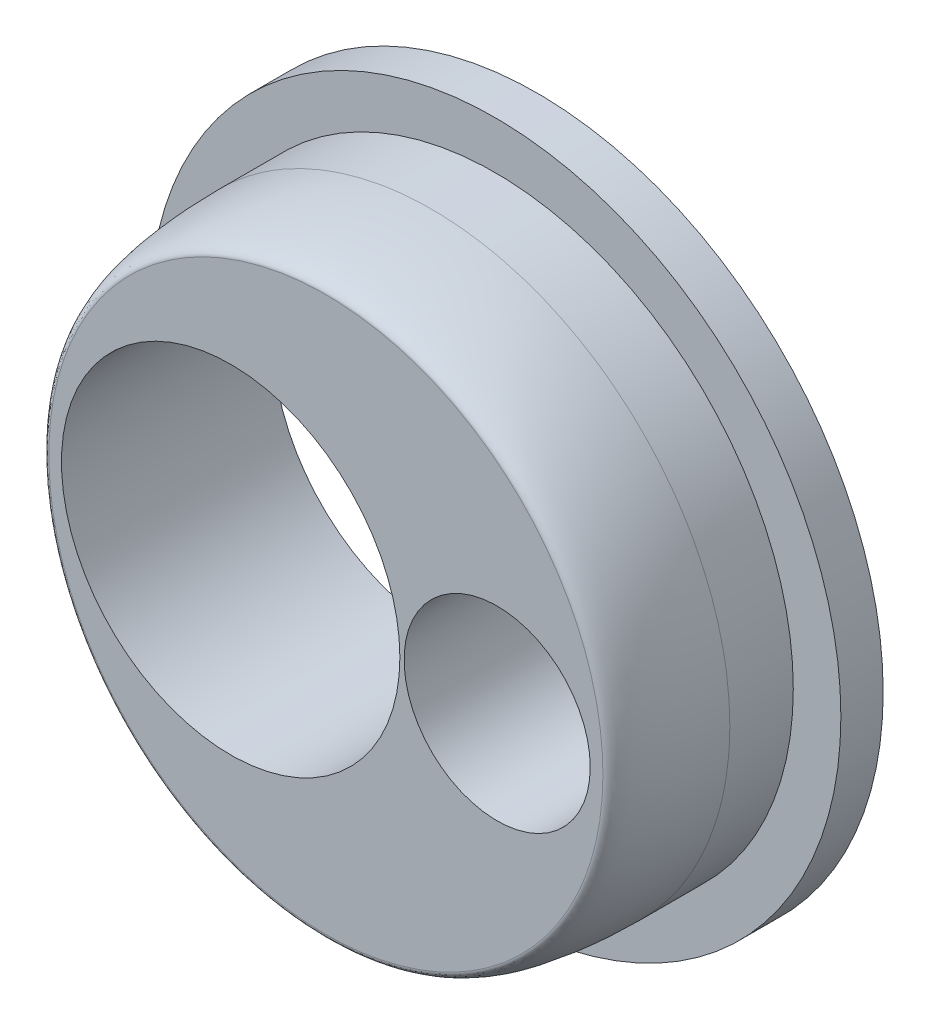
from build123d import *

# Parameters (mm, degrees)
SKETCH_1_R      = 16.35
SKETCH_1_R_2    = 4.4
SKETCH_1_R_3    = 8
EXTRUDE_1_DEPTH = 2
SKETCH_2_R      = 14.1
SKETCH_2_R_2    = 4.4
SKETCH_2_R_3    = 8
EXTRUDE_2_DEPTH = 8
FILLET_1_SIZE   = 5
FILLET_1_SIZE_2 = 1


with BuildPart() as part:
    # 草图1 → 凸台-拉伸1 (new body)
    with BuildSketch(Plane.XY):
        Circle(SKETCH_1_R)
        with Locations((8.1, 0)):
            Circle(SKETCH_1_R_2, mode=Mode.SUBTRACT)
        with Locations((-4.5, 0)):
            Circle(SKETCH_1_R_3, mode=Mode.SUBTRACT)
    extrude(amount=EXTRUDE_1_DEPTH)

    # 草图2 → 凸台-拉伸2 (add)
    with BuildSketch(Plane.XY.offset(2)):
        Circle(SKETCH_2_R)
        with Locations((8.1, 0)):
            Circle(SKETCH_2_R_2, mode=Mode.SUBTRACT)
        with Locations((-4.5, 0)):
            Circle(SKETCH_2_R_3, mode=Mode.SUBTRACT)
    extrude(amount=EXTRUDE_2_DEPTH)

    # 圆角1
    # an asymmetric fillet: 5, 1 mm, written as the material it takes off along each edge
    with BuildSketch(Plane(origin=(0, 0, 10), x_dir=(1, 0, 0), z_dir=(0, -1, 0))) as fillet_1_piece_1:
        with BuildLine():
            Bezier((14.1, -FILLET_1_SIZE), (14.1, 0), (14.1 - FILLET_1_SIZE_2, 0), weights=[1, 0.707106781, 1])
            Line((14.1 - FILLET_1_SIZE_2, 0), (14.1, 0))
            Line((14.1, 0), (14.1, -FILLET_1_SIZE))
        make_face()
    revolve(axis=Axis((0, 0, 10), (0, 0, 1)), mode=Mode.SUBTRACT)


solid = part.part
